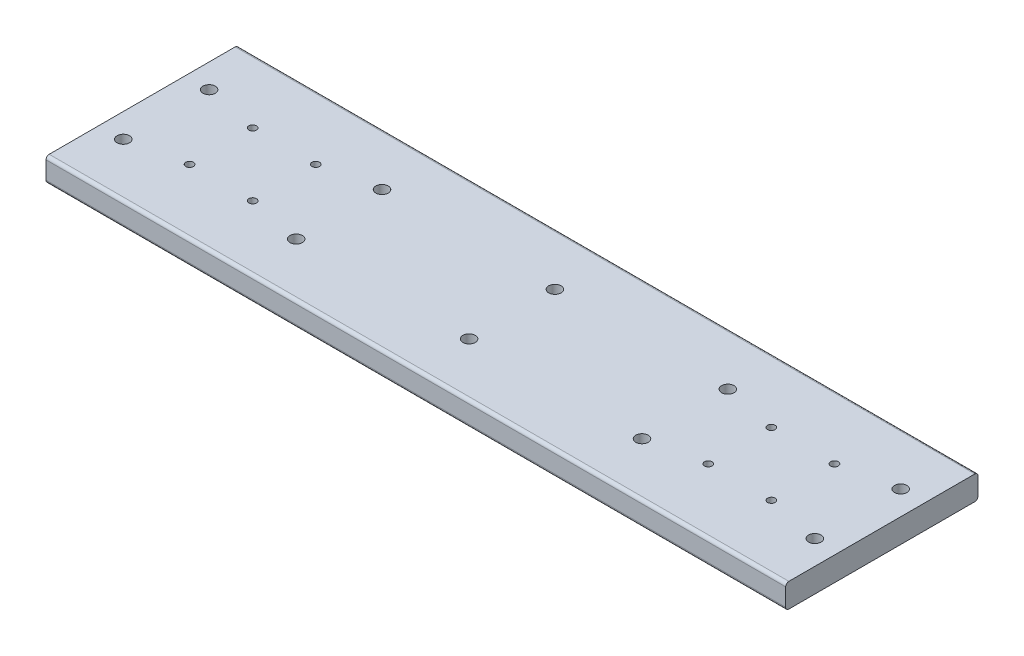
from build123d import *

# Parameters (mm, degrees)
SKETCH1_W                    = 76.2
SKETCH1_H                    = 9.525
BOSS_EXTRUDE1_DEPTH          = 146.524999939
F_10_0_1935_DIAMETER_HOLE4_D = 4.9149
FILLET1_R                    = 1.27
F_3_0MM_DOWEL_HOLE1_D        = 3


with BuildPart() as part:
    # Sketch1 → Boss-Extrude1 (new, symmetric)
    with BuildSketch(Plane(origin=(0, 0, 0), x_dir=(0, 0, -1), z_dir=(1, 0, 0))):
        with Locations((0, 4.7625)):
            Rectangle(SKETCH1_W, SKETCH1_H)
    extrude(amount=BOSS_EXTRUDE1_DEPTH, both=True)

    # #10 (0.1935) Diameter Hole4 (through all)
    with Locations(Plane(origin=(0, 9.525, 0), x_dir=(1, 0, 0), z_dir=(0, 1, 0))):
        with Locations((-137, 17.000000036), (-137, -17.000000036), (-68.5, 17.000000036), (-68.5, -17.000000036), (0, 17.000000036), (0, -17.000000036), (68.5, 17.000000036), (68.5, -17.000000036), (137, 17.000000036), (137, -17.000000036)):
            Hole(F_10_0_1935_DIAMETER_HOLE4_D / 2)

    # Fillet1
    fillet1_edges = [part.edges().sort_by_distance(p)[0] for p in [
        (0, 0, -38.1),
        (0, 9.525, -38.1),
        (0, 9.525, 38.1),
        (0, 0, 38.1),
    ]]
    fillet(fillet1_edges, radius=FILLET1_R)

    # Ø3.0mm Dowel Hole1 (through all)
    with Locations(Plane(origin=(0, 9.525, 0), x_dir=(1, 0, 0), z_dir=(0, 1, 0))):
        with Locations((-115.25, 12.5), (-115.25, -12.5), (-90.25, 12.5), (-90.25, -12.5), (90.25, 12.5), (90.25, -12.5), (115.25, 12.5), (115.25, -12.5)):
            Hole(F_3_0MM_DOWEL_HOLE1_D / 2)


solid = part.part
